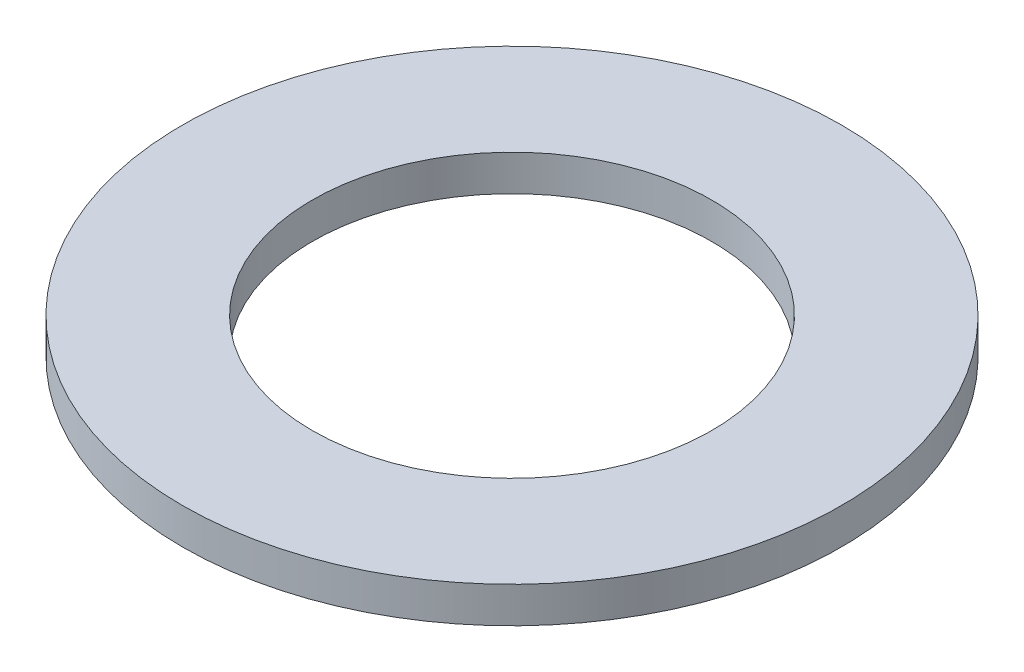
from build123d import *

# Parameters (mm, degrees)
SKETCH1_R           = 82.5
BOSS_EXTRUDE1_DEPTH = 9
SKETCH2_R           = 50
CUT_EXTRUDE1_DEPTH  = 118.019229189


with BuildPart() as part:
    # Sketch1 → Boss-Extrude1 (new body)
    with BuildSketch(Plane(origin=(0, 0, 0), x_dir=(1, 0, 0), z_dir=(0, 1, 0))):
        Circle(SKETCH1_R)
    extrude(amount=BOSS_EXTRUDE1_DEPTH)

    # Sketch2 → Cut-Extrude1 (cut, through all)
    with BuildSketch(Plane(origin=(0, 0, 0), x_dir=(1, 0, 0), z_dir=(0, 1, 0))):
        Circle(SKETCH2_R)
    extrude(amount=CUT_EXTRUDE1_DEPTH, mode=Mode.SUBTRACT)


solid = part.part
